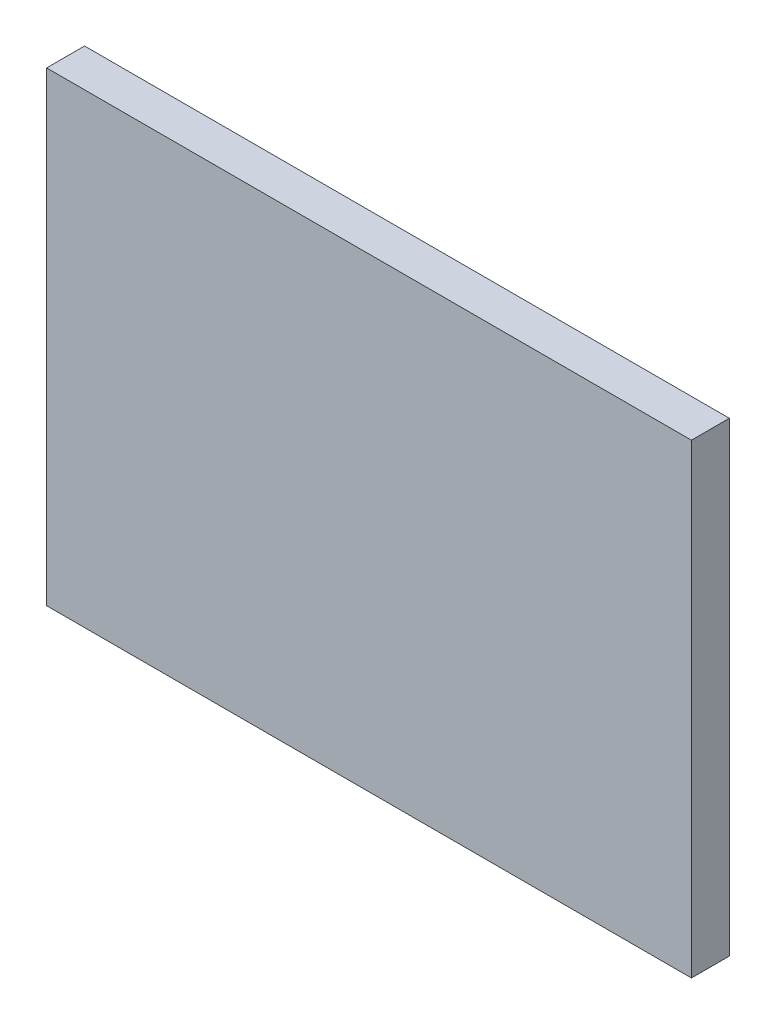
from build123d import *

# Parameters (mm, degrees)
SKETCH1_W           = 107.95
SKETCH1_H           = 77.978
BOSS_EXTRUDE1_DEPTH = 6.35


with BuildPart() as part:
    # Sketch1 → Boss-Extrude1 (new body)
    with BuildSketch(Plane.XY):
        Rectangle(SKETCH1_W, SKETCH1_H)
    extrude(amount=BOSS_EXTRUDE1_DEPTH)


solid = part.part
